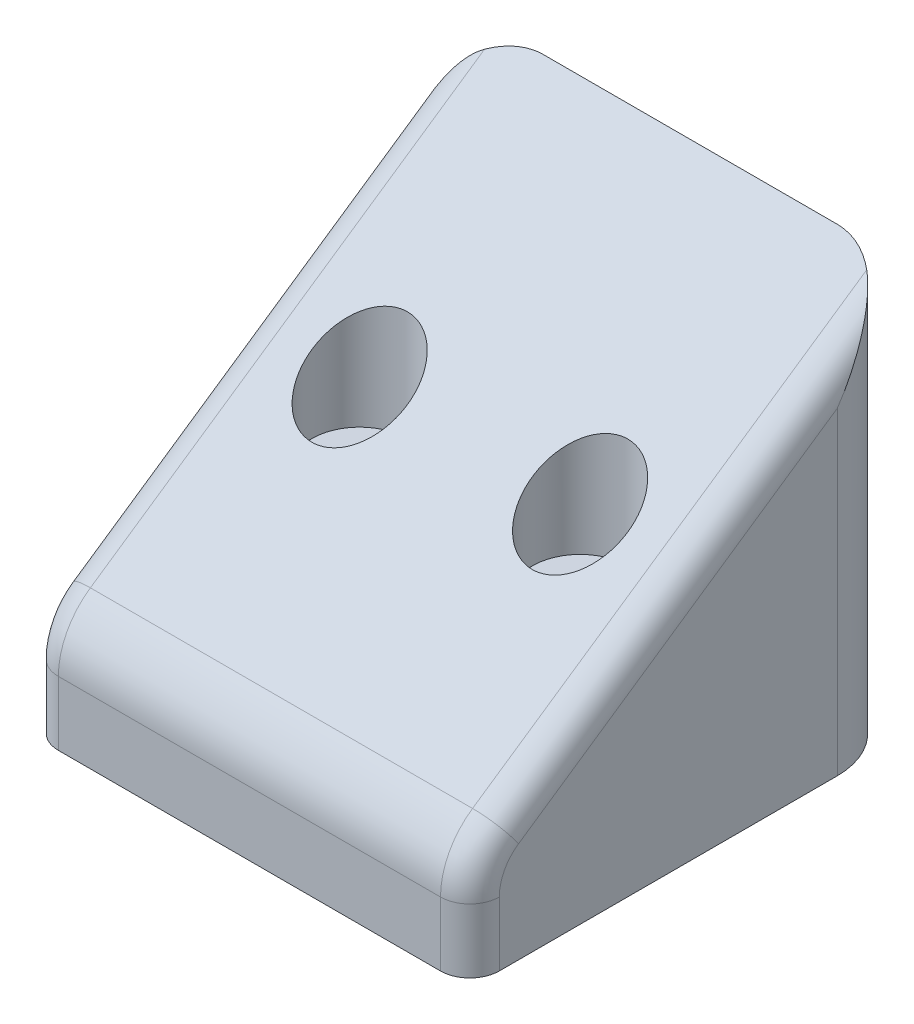
from build123d import *

# Parameters (mm, degrees)
SKETCH1_W              = 30
SKETCH1_H              = 27.5
EXTRUDE1_DEPTH         = 30
EXTRUDE3_DEPTH         = 45.598906937
SKETCH7_R              = 1.25
CUT_EXTRUDE_1045_DEPTH = 11
SKETCH8_R              = 3.25
EXTRUDE8_DEPTH         = 15.5
EXTRUDE9_DEPTH         = 44.373378932
EXTRUDE9_DEPTH_BACK    = 44.373378932
SKETCH9_R              = 1.5
FILLET1_R              = 5
FILLET3_R              = 2


with BuildPart() as part:
    # Sketch1 → Extrude1 (new body)
    with BuildSketch(Plane.XY):
        Rectangle(SKETCH1_W, SKETCH1_H)
    extrude(amount=EXTRUDE1_DEPTH)

    # Sketch3 → Extrude3 (cut, through all)
    with BuildSketch(Plane(origin=(15, 0, 0), x_dir=(0, 0, -1), z_dir=(1, 0, 0))):
        Polygon((-30, -6.75), (-30, 13.75), (0, 13.75), align=None)
    extrude(amount=-EXTRUDE3_DEPTH, mode=Mode.SUBTRACT)

    # Sketch7 → Cut-Extrude 1045 (cut)
    with BuildSketch(Plane(origin=(0, 0, 0), x_dir=(-1, 0, 0), z_dir=(0, 0, -1))):
        with Locations((-4.95, 3.65)):
            Circle(SKETCH7_R)
        with Locations((4.95, 3.65)):
            Circle(SKETCH7_R)
        with Locations((4.95, -6.25)):
            Circle(SKETCH7_R)
        with Locations((-4.95, -6.25)):
            Circle(SKETCH7_R)
    extrude(amount=-CUT_EXTRUDE_1045_DEPTH, mode=Mode.SUBTRACT)

    # Sketch8 → Extrude8 (cut)
    with BuildSketch(Plane(origin=(0, 13.75, 0), x_dir=(1, 0, 0), z_dir=(0, 1, 0))):
        with Locations(Location((-7.5, -15, 0), (0, 0, 270))):
            Circle(SKETCH8_R)
        with Locations(Location((7.5, -15, 0), (0, 0, 270))):
            Circle(SKETCH8_R)
    extrude(amount=-EXTRUDE8_DEPTH, mode=Mode.SUBTRACT)

    # Sketch9 → Extrude9 (cut, two sides: drawn at the far end of the back side and taken through both)
    with BuildSketch(Plane(origin=(0, 13.75, 0), x_dir=(1, 0, 0), z_dir=(0, 1, 0)).offset(-EXTRUDE9_DEPTH_BACK)):
        with Locations(Location((-7.5, -15, 0), (0, 0, 270))):
            Circle(SKETCH9_R)
        with Locations(Location((7.5, -15, 0), (0, 0, 270))):
            Circle(SKETCH9_R)
    extrude(amount=EXTRUDE9_DEPTH + EXTRUDE9_DEPTH_BACK, mode=Mode.SUBTRACT)

    # Fillet1
    fillet1_edges = [part.edges().sort_by_distance(p)[0] for p in [
        (0, -6.75, 30),
        (15, 0, 0),
        (-15, 0, 0),
    ]]
    fillet(fillet1_edges, radius=FILLET1_R)

    # Fillet3
    # the kernel refuses this fillet: 2 mm, written as the material it takes off along each edge
    with BuildSketch(Plane(origin=(15, -18.75, 30), x_dir=(-1, 0, 0), z_dir=(0, 1, 0))) as fillet3_piece_1:
        with BuildLine():
            CenterArc((FILLET3_R, -FILLET3_R), FILLET3_R, 90, 90)
            Line((0, -FILLET3_R), (0, 0))
            Line((0, 0), (FILLET3_R, 0))
        make_face()
    extrude(amount=9.360792567, mode=Mode.SUBTRACT)
    with BuildSketch(Plane(origin=(-15, -9.389207433, 30), x_dir=(0, 0, -1), z_dir=(0, -1, 0))) as fillet3_piece_2:
        with BuildLine():
            CenterArc((FILLET3_R, FILLET3_R), FILLET3_R, 180, 90)
            Line((0, FILLET3_R), (0, 0))
            Line((0, 0), (FILLET3_R, 0))
        make_face()
    extrude(amount=9.360792567, mode=Mode.SUBTRACT)
    with BuildSketch(Plane(origin=(-15, 13.154285858, 0.871776792), x_dir=(0, -0.8256446415008141, -0.5641905050255563), z_dir=(0, -0.5641905050255562, 0.8256446415008141))) as fillet3_piece_3:
        with BuildLine():
            CenterArc((FILLET3_R, FILLET3_R), FILLET3_R, 180, 90)
            Line((0, FILLET3_R), (0, 0))
            Line((0, 0), (FILLET3_R, 0))
        make_face()
    extrude(amount=32.640163065, mode=Mode.SUBTRACT)
    with BuildSketch(Plane(origin=(15, 13.154285858, 0.871776792), x_dir=(0, -0.8256446415008141, -0.5641905050255563), z_dir=(0, -0.5641905050255562, 0.8256446415008141))) as fillet3_piece_4:
        with BuildLine():
            CenterArc((FILLET3_R, -FILLET3_R), FILLET3_R, 90, 90)
            Line((0, -FILLET3_R), (0, 0))
            Line((0, 0), (FILLET3_R, 0))
        make_face()
    extrude(amount=32.640163065, mode=Mode.SUBTRACT)
    with BuildSketch(Plane(origin=(15, -9.389207433, 25), x_dir=(0, 0, 1), z_dir=(0, -1, 0))) as fillet3_piece_5:
        with BuildLine():
            CenterArc((5 - FILLET3_R, FILLET3_R), FILLET3_R, 270, 90)
            Line((5, FILLET3_R), (5, 0))
            Line((5, 0), (5 - FILLET3_R, 0))
        make_face()
    revolve(axis=Axis((15, -9.389207433, 25), (-1, 0, 0)), revolution_arc=55.6539026, mode=Mode.SUBTRACT)
    with BuildSketch(Plane(origin=(-15, -9.389207433, 25), x_dir=(0, 0, 1), z_dir=(0, -1, 0))) as fillet3_piece_6:
        with BuildLine():
            CenterArc((5 - FILLET3_R, -FILLET3_R), FILLET3_R, 0, 90)
            Line((5, -FILLET3_R), (5, 0))
            Line((5, 0), (5 - FILLET3_R, 0))
        make_face()
    revolve(axis=Axis((-15, -9.389207433, 25), (-1, 0, 0)), revolution_arc=55.6539026, mode=Mode.SUBTRACT)


solid = part.part
